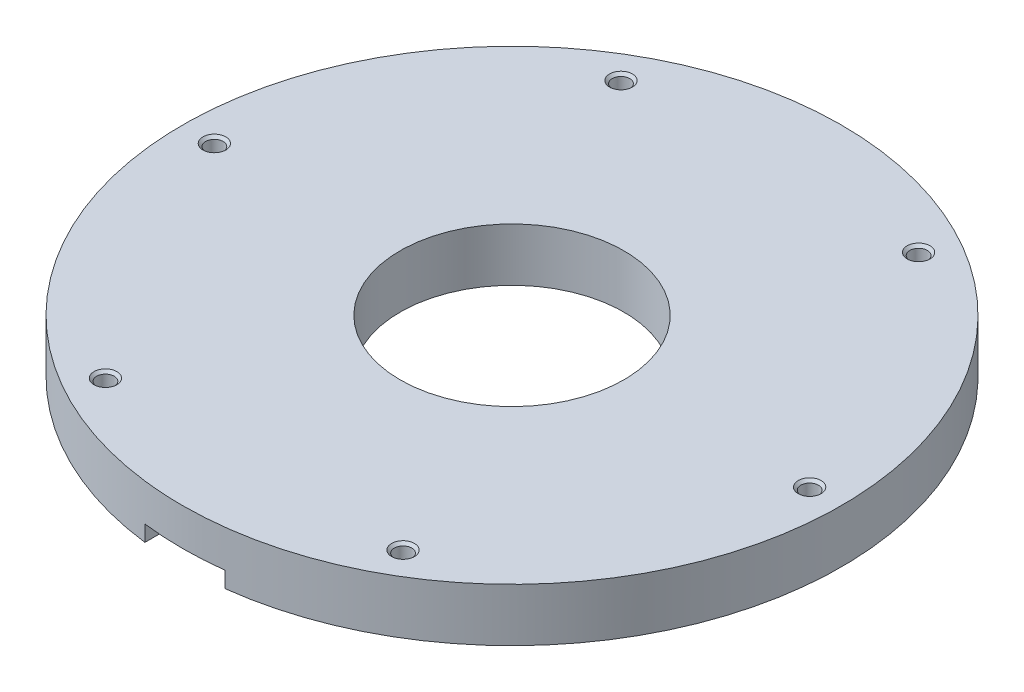
from build123d import *

# Parameters (mm, degrees)
SKETCH1_R                    = 62
SKETCH1_R_2                  = 21.05
BOSS_EXTRUDE1_DEPTH          = 10
SKETCH3_R                    = 1.65
CUT_EXTRUDE1_DEPTH           = 89.249645892
CHAMFER1_SIZE                = 0.5
CIRPATTERN1_COUNT            = 6
CHAMFER1_OF_CIRPATTERN1_SIZE = 0.5
CUT_EXTRUDE2_DEPTH           = 3


with BuildPart() as part:
    # Sketch1 → Boss-Extrude1 (new body)
    with BuildSketch(Plane(origin=(0, 0, 0), x_dir=(1, 0, 0), z_dir=(0, 1, 0))):
        Circle(SKETCH1_R)
        Circle(SKETCH1_R_2, mode=Mode.SUBTRACT)
    extrude(amount=BOSS_EXTRUDE1_DEPTH)

    # Sketch3 → Cut-Extrude1 (cut, through all)
    with BuildSketch(Plane(origin=(0, 10, 0), x_dir=(1, 0, 0), z_dir=(0, 1, 0))):
        with Locations((-56, 0)):
            Circle(SKETCH3_R)
    cut_extrude1 = extrude(amount=-CUT_EXTRUDE1_DEPTH, mode=Mode.SUBTRACT)

    # Chamfer1
    chamfer1_edges = [part.edges().sort_by_distance(p)[0] for p in [
        (-57.65, 10, 0),
    ]]
    chamfer(chamfer1_edges, length=CHAMFER1_SIZE)

    # CirPattern1: Cut-Extrude1 ×6 about axis
    cirpattern1_axis = Axis((0, 10, 0), (0, 1, 0))
    for i in range(1, CIRPATTERN1_COUNT):
        add(cut_extrude1.rotate(cirpattern1_axis, i * 360 / CIRPATTERN1_COUNT), mode=Mode.SUBTRACT)

    # Chamfer1 of CirPattern1
    chamfer1_of_cirpattern1_edges = [part.edges().sort_by_distance(p)[0] for p in [
        (-28.825, 10, 49.926364528),
        (28.825, 10, 49.926364528),
        (57.65, 10, 0),
        (28.825, 10, -49.926364528),
        (-28.825, 10, -49.926364528),
    ]]
    chamfer(chamfer1_of_cirpattern1_edges, length=CHAMFER1_OF_CIRPATTERN1_SIZE)

    # Sketch4 → Cut-Extrude2 (cut)
    with BuildSketch(Plane.XZ):
        with BuildLine():
            ThreePointArc((7.525, 61.541647484), (3.769473174, 61.885305784), (0, 62))
            ThreePointArc((0, 62), (-3.769473174, 61.885305784), (-7.525, 61.541647484))
            Line((-7.525, 61.541647484), (-7.525, 32))
            Line((-7.525, 32), (7.525, 32))
            Line((7.525, 32), (7.525, 61.541647484))
        make_face()
    extrude(amount=-CUT_EXTRUDE2_DEPTH, mode=Mode.SUBTRACT)


solid = part.part
